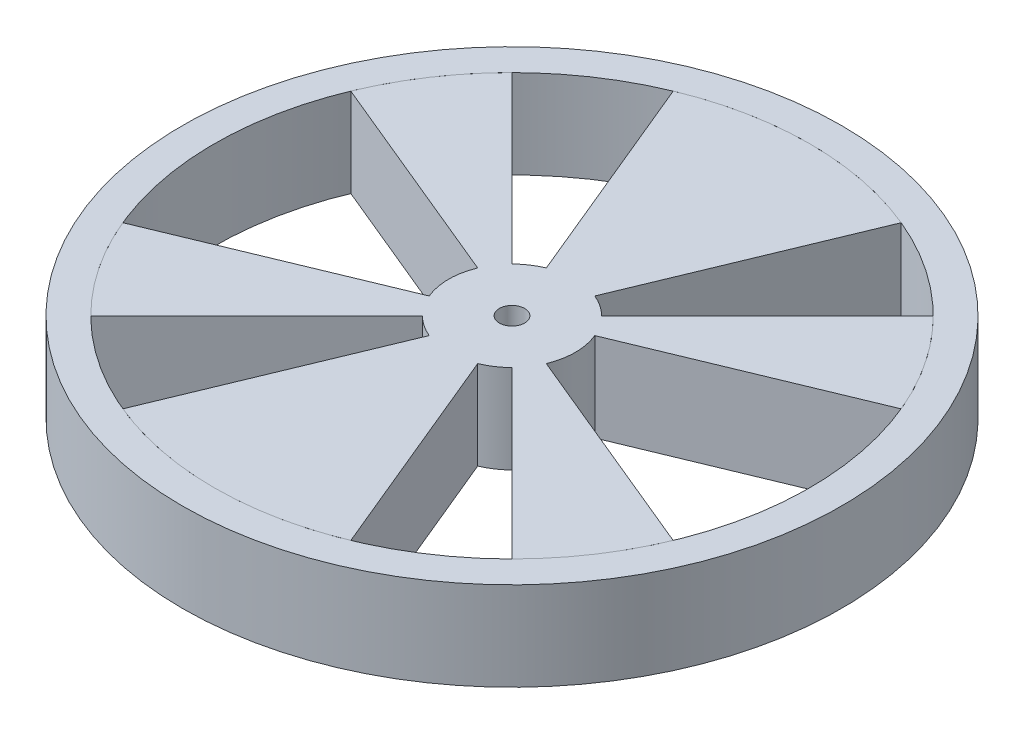
from build123d import *

# Parameters (mm, degrees)
SKETCH2_R           = 26
BOSS_EXTRUDE1_DEPTH = 7
SKETCH4_R           = 23.5
CUT_EXTRUDE2_DEPTH  = 7
SKETCH3_5_R         = 1
BOSS_EXTRUDE3_DEPTH = 7


with BuildPart() as part:
    # Sketch2 → Boss-Extrude1 (new body)
    with BuildSketch(Plane(origin=(0, 0, 0), x_dir=(1, 0, 0), z_dir=(0, 1, 0))):
        Circle(SKETCH2_R)
    extrude(amount=BOSS_EXTRUDE1_DEPTH)

    # Sketch4 → Cut-Extrude2 (cut)
    with BuildSketch(Plane(origin=(0, 7, 0), x_dir=(1, 0, 0), z_dir=(0, 1, 0))):
        Circle(SKETCH4_R)
    extrude(amount=-CUT_EXTRUDE2_DEPTH, mode=Mode.SUBTRACT)


with BuildPart() as body_2:
    # Sketch3<5> → Boss-Extrude3 (new body)
    with BuildSketch(Plane(origin=(0, 7, 0), x_dir=(1, 0, 0), z_dir=(0, 1, 0))):
        with BuildLine():
            ThreePointArc((-4.619397663, 1.913417162), (-5, 0), (-4.619397663, -1.913417162))
            Line((-4.619397663, -1.913417162), (-21.711169014, -8.993060661))
            ThreePointArc((-21.711169014, -8.993060661), (-19.539535889, -13.055900476), (-16.617009358, -16.617009358))
            Line((-16.617009358, -16.617009358), (-3.535533906, -3.535533906))
            ThreePointArc((-3.535533906, -3.535533906), (-2.777851165, -4.157348062), (-1.913417162, -4.619397663))
            Line((-1.913417162, -4.619397663), (-8.993060661, -21.711169014))
            ThreePointArc((-8.993060661, -21.711169014), (0, -23.5), (8.993060661, -21.711169014))
            Line((8.993060661, -21.711169014), (1.913417162, -4.619397663))
            ThreePointArc((1.913417162, -4.619397663), (2.777851165, -4.157348062), (3.535533906, -3.535533906))
            Line((3.535533906, -3.535533906), (16.617009358, -16.617009358))
            ThreePointArc((16.617009358, -16.617009358), (19.539535889, -13.055900476), (21.711169014, -8.993060661))
            Line((21.711169014, -8.993060661), (4.619397663, -1.913417162))
            ThreePointArc((4.619397663, -1.913417162), (5, 0), (4.619397663, 1.913417162))
            Line((4.619397663, 1.913417162), (21.711169014, 8.993060661))
            ThreePointArc((21.711169014, 8.993060661), (19.539535889, 13.055900476), (16.617009358, 16.617009358))
            Line((16.617009358, 16.617009358), (3.535533906, 3.535533906))
            ThreePointArc((3.535533906, 3.535533906), (2.777851165, 4.157348062), (1.913417162, 4.619397663))
            Line((1.913417162, 4.619397663), (8.993060661, 21.711169014))
            ThreePointArc((8.993060661, 21.711169014), (0, 23.5), (-8.993060661, 21.711169014))
            Line((-8.993060661, 21.711169014), (-1.913417162, 4.619397663))
            ThreePointArc((-1.913417162, 4.619397663), (-2.777851165, 4.157348062), (-3.535533906, 3.535533906))
            Line((-3.535533906, 3.535533906), (-16.617009358, 16.617009358))
            ThreePointArc((-16.617009358, 16.617009358), (-19.539535889, 13.055900476), (-21.711169014, 8.993060661))
            Line((-21.711169014, 8.993060661), (-4.619397663, 1.913417162))
        make_face()
        Circle(SKETCH3_5_R, mode=Mode.SUBTRACT)
    extrude(amount=-BOSS_EXTRUDE3_DEPTH)


solid = Compound([part.part, body_2.part])
